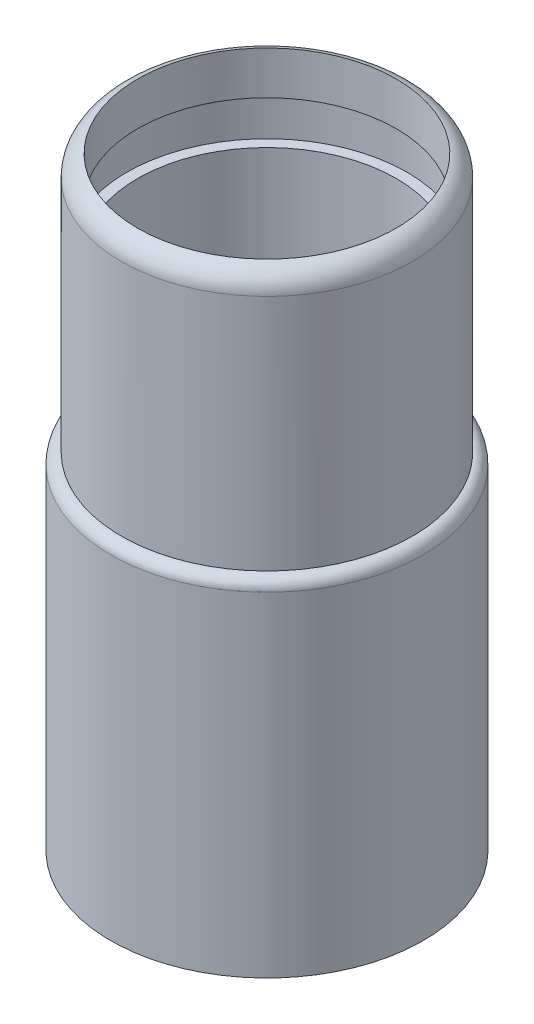
from build123d import *

# Parameters (mm, degrees)
SKETCH1_R           = 3.375
SKETCH1_R_2         = 3
BOSS_EXTRUDE1_DEPTH = 14
SKETCH2_R           = 3.625
SKETCH2_R_2         = 3
BOSS_EXTRUDE2_DEPTH = 8
FILLET1_R           = 0.25
BOSS_EXTRUDE3_START = -0.5
SKETCH3_R           = 3.375
SKETCH3_R_2         = 3
BOSS_EXTRUDE3_DEPTH = 0.5
FILLET2_R           = 0.5
SKETCH4_R           = 3.25
CUT_EXTRUDE1_DEPTH  = 4
SKETCH5_R           = 3.25
CUT_EXTRUDE2_DEPTH  = 1


# Some blends are built 0.0001 mm under size
with BuildPart() as part:
    # Sketch1 → Boss-Extrude1 (new body)
    with BuildSketch(Plane(origin=(0, 0, 0), x_dir=(1, 0, 0), z_dir=(0, 1, 0))):
        with Locations(Location((0, 0, 0), (0, 0, 270))):
            Circle(SKETCH1_R)
        with Locations(Location((0, 0, 0), (0, 0, 270))):
            Circle(SKETCH1_R_2, mode=Mode.SUBTRACT)
    extrude(amount=BOSS_EXTRUDE1_DEPTH)

    # Sketch2 → Boss-Extrude2 (add)
    with BuildSketch(Plane.XZ):
        with Locations(Location((0, 0, 0), (0, 0, 270))):
            Circle(SKETCH2_R)
        with Locations(Location((0, 0, 0), (0, 0, 90))):
            Circle(SKETCH2_R_2, mode=Mode.SUBTRACT)
    extrude(amount=-BOSS_EXTRUDE2_DEPTH)

    # Fillet1
    fillet1_edges = [part.edges().sort_by_distance(p)[0] for p in [
        (0, 8, 3.625),
    ]]
    fillet(fillet1_edges, radius=FILLET1_R - 0.0001)  # a hair under: the kernel refuses the full size

    # Sketch3 → Boss-Extrude3 (add)
    with BuildSketch(Plane(origin=(0, 14, 0), x_dir=(1, 0, 0), z_dir=(0, 1, 0)).offset(BOSS_EXTRUDE3_START)):
        with Locations(Location((0, 0, 0), (0, 0, 90))):
            Circle(SKETCH3_R)
        with Locations(Location((0, 0, 0), (0, 0, 270))):
            Circle(SKETCH3_R_2, mode=Mode.SUBTRACT)
    extrude(amount=BOSS_EXTRUDE3_DEPTH)

    # Fillet2
    # the kernel refuses this fillet: 0.5 mm, written as the material it takes off along each edge
    with BuildSketch(Plane(origin=(0, 14, 0), x_dir=(0, 0, 1), z_dir=(1, 0, 0))) as fillet2_piece_1:
        with BuildLine():
            CenterArc((2.875, 0.484122918), FILLET2_R, 284.477512186, 75.522487814)
            Line((3.375, 0.484122918), (3.385, 0.484122918))
            Line((3.385, 0.484122918), (3.385, 0))
            Line((3.385, 0), (3.375, -0.01))
            ThreePointArc((3.375, -0.01), (3.1875, -0.01), (3.0025, -0.009682458))
            Line((3.0025, -0.009682458), (3, 0))
        make_face()
    revolve(axis=Axis((0, 14, 0), (0, -1, 0)), mode=Mode.SUBTRACT)

    # Sketch4 → Cut-Extrude1 (cut)
    with BuildSketch(Plane.XZ):
        with Locations(Location((0, 0, 0), (0, 0, 270))):
            Circle(SKETCH4_R)
    extrude(amount=-CUT_EXTRUDE1_DEPTH, mode=Mode.SUBTRACT)

    # Sketch5 → Cut-Extrude2 (cut)
    with BuildSketch(Plane(origin=(0, 12, 0), x_dir=(-1, 0, 0), z_dir=(0, -1, 0))):
        with Locations(Location((0, 0, 0), (0, 0, 90))):
            Circle(SKETCH5_R)
    extrude(amount=-CUT_EXTRUDE2_DEPTH, mode=Mode.SUBTRACT)


solid = part.part
